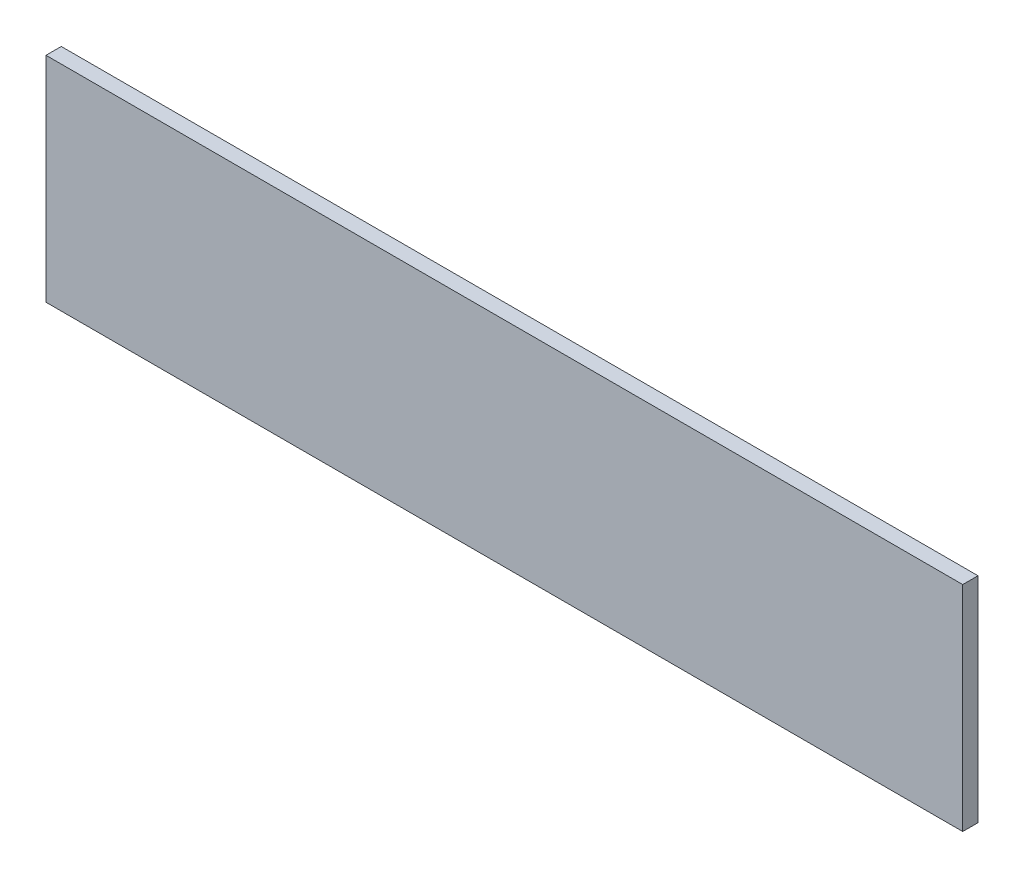
from build123d import *

# Parameters (mm, degrees)
ESQUISSE1_W        = 600
ESQUISSE1_H        = 140
BOSS_EXTRU_1_DEPTH = 10


with BuildPart() as part:
    # Esquisse1 → Boss.-Extru.1 (new body)
    with BuildSketch(Plane.XY):
        with Locations((300, 70)):
            Rectangle(ESQUISSE1_W, ESQUISSE1_H)
    extrude(amount=BOSS_EXTRU_1_DEPTH)


solid = part.part
